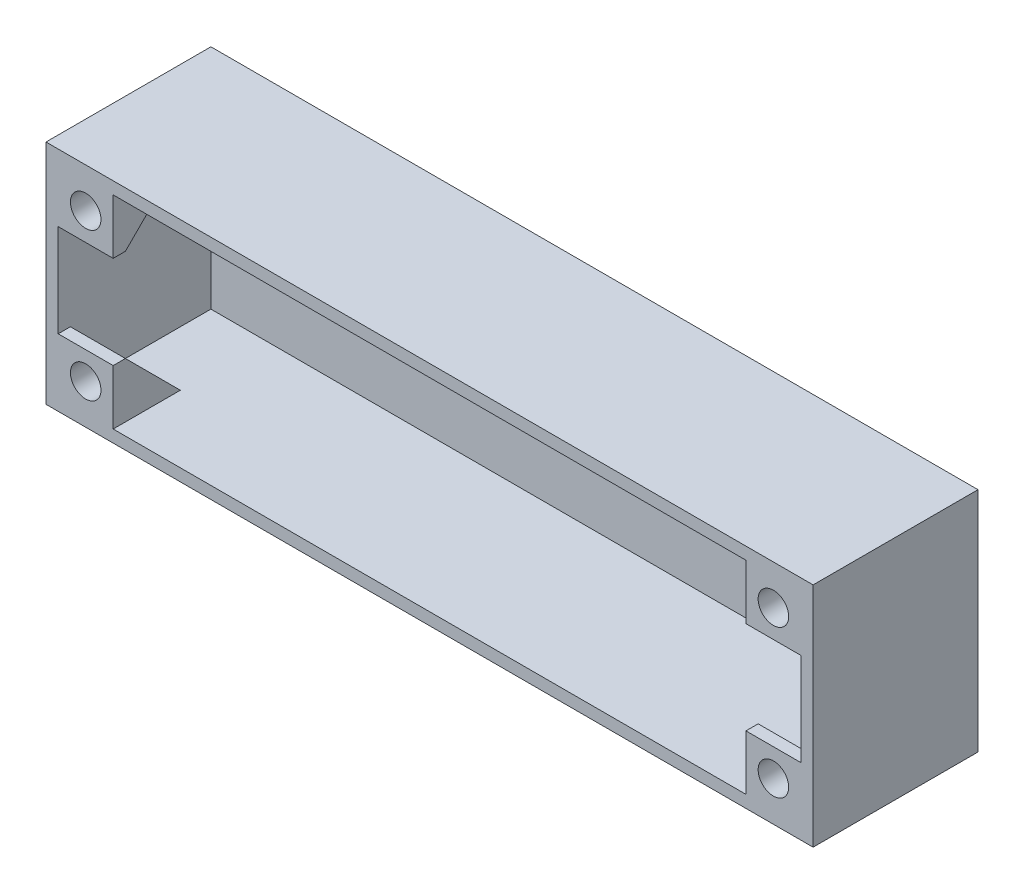
from build123d import *

# Parameters (mm, degrees)
SKETCH1_W           = 125.6
SKETCH1_H           = 37.2
SKETCH1_W_2         = 121.6
SKETCH1_H_2         = 33.2
BOSS_EXTRUDE1_DEPTH = 25
SKETCH2_W           = 125.6
SKETCH2_H           = 37.2
BOSS_EXTRUDE2_DEPTH = 2
SKETCH3_W           = 9
SKETCH3_H           = 9
BOSS_EXTRUDE3_DEPTH = 2
CHAMFER1_SIZE       = 9
SKETCH4_R           = 2.5
CUT_EXTRUDE1_DEPTH  = 15


with BuildPart() as part:
    # Sketch1 → Boss-Extrude1 (new body)
    with BuildSketch(Plane(origin=(0, 0, -81.397696965), x_dir=(-1, 0, 0), z_dir=(0, 0, -1))):
        with Locations((-34.603078278, 93.138059859)):
            Rectangle(SKETCH1_W, SKETCH1_H)
        with Locations((-34.603078278, 93.138059859)):
            Rectangle(SKETCH1_W_2, SKETCH1_H_2, mode=Mode.SUBTRACT)
    extrude(amount=BOSS_EXTRUDE1_DEPTH)

    # Sketch2 → Boss-Extrude2 (add)
    with BuildSketch(Plane(origin=(0, 0, -106.397696965), x_dir=(-1, 0, 0), z_dir=(0, 0, -1))):
        with Locations((-34.603078278, 93.138059859)):
            Rectangle(SKETCH2_W, SKETCH2_H)
    extrude(amount=BOSS_EXTRUDE2_DEPTH)

    # Sketch3 → Boss-Extrude3 (add)
    with BuildSketch(Plane.XY.offset(-81.397696965)):
        with Locations((90.903078278, 105.238059859)):
            Rectangle(SKETCH3_W, SKETCH3_H)
        with Locations((90.903078278, 81.038059859)):
            Rectangle(SKETCH3_W, SKETCH3_H)
        with Locations((-21.696921722, 105.238059859)):
            Rectangle(SKETCH3_W, SKETCH3_H)
        with Locations((-21.696921722, 81.038059859)):
            Rectangle(SKETCH3_W, SKETCH3_H)
    extrude(amount=-BOSS_EXTRUDE3_DEPTH)

    # Chamfer1
    chamfer1_edges = [part.edges().sort_by_distance(p)[0] for p in [
        (-21.696921722, 76.538059859, -83.397696965),
        (90.903078278, 76.538059859, -83.397696965),
        (90.903078278, 109.738059859, -83.397696965),
        (-21.696921722, 109.738059859, -83.397696965),
    ]]
    chamfer(chamfer1_edges, length=CHAMFER1_SIZE - 0.0001)  # a hair under: the kernel refuses the full size

    # Sketch4 → Cut-Extrude1 (cut)
    with BuildSketch(Plane.XY.offset(-81.397696965)):
        with Locations((-21.696921722, 105.238059859)):
            Circle(SKETCH4_R)
        with Locations((-21.696921722, 81.038059859)):
            Circle(SKETCH4_R)
        with Locations((90.903078278, 81.038059859)):
            Circle(SKETCH4_R)
        with Locations((90.903078278, 105.238059859)):
            Circle(SKETCH4_R)
    extrude(amount=-CUT_EXTRUDE1_DEPTH, mode=Mode.SUBTRACT)


solid = part.part
